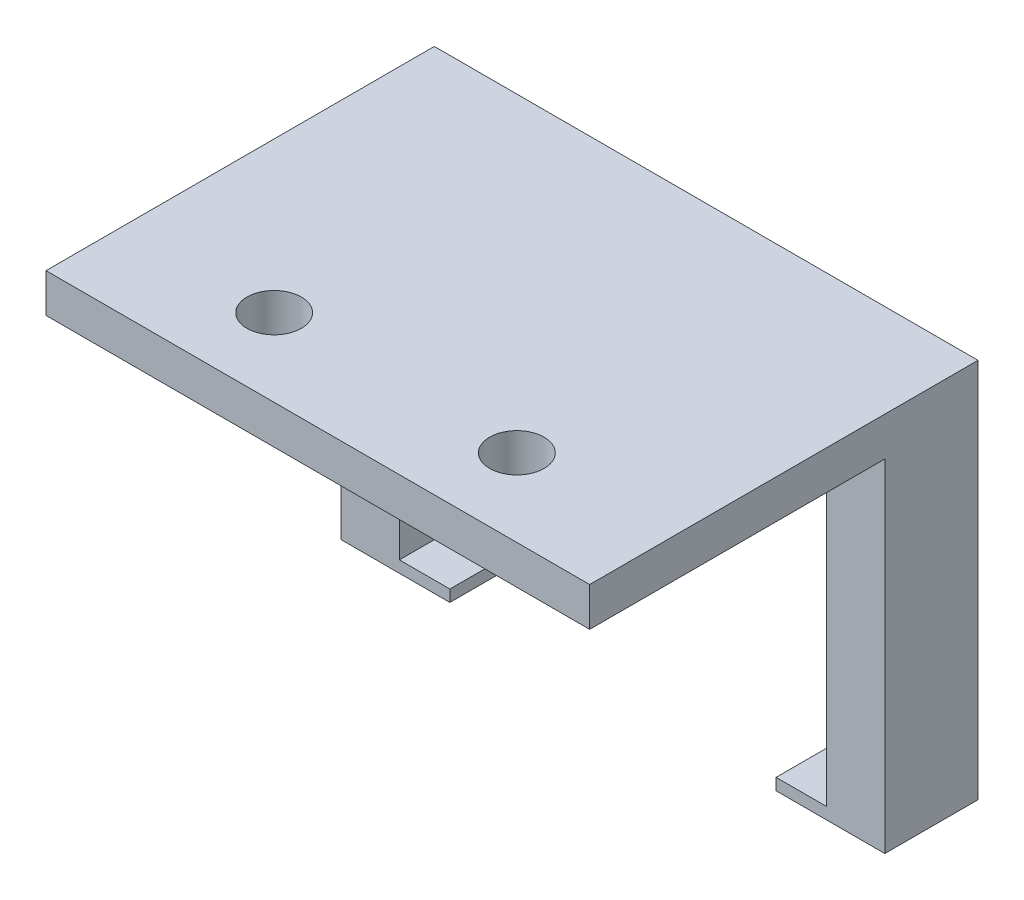
from build123d import *

# Parameters (mm, degrees)
SKETCH3_W           = 35.56
SKETCH3_H           = 25.4
SKETCH3_R           = 1.778
BOSS_EXTRUDE3_DEPTH = 2.54
SKETCH4_W           = 3.81
SKETCH4_H           = 11.176
BOSS_EXTRUDE4_DEPTH = 22.352
SKETCH5_W           = 11.176
SKETCH5_H           = 0.762
BOSS_EXTRUDE5_DEPTH = 3.302
SKETCH6_W           = 11.176
SKETCH6_H           = 0.762
BOSS_EXTRUDE6_DEPTH = 3.302
SKETCH7_W           = 35.56
SKETCH7_H           = 22.352
CUT_EXTRUDE1_DEPTH  = 5.08


with BuildPart() as part:
    # Sketch3 → Boss-Extrude3 (new body)
    with BuildSketch(Plane(origin=(0, 0, 0), x_dir=(1, 0, 0), z_dir=(0, 1, 0))):
        with Locations((6.262748092, -0.232671756)):
            Rectangle(SKETCH3_W, SKETCH3_H)
        with Locations((-1.674751908, -7.852671756)):
            Circle(SKETCH3_R, mode=Mode.SUBTRACT)
        with Locations((14.200248092, -7.852671756)):
            Circle(SKETCH3_R, mode=Mode.SUBTRACT)
    extrude(amount=BOSS_EXTRUDE3_DEPTH)

    # Sketch4 → Boss-Extrude4 (add)
    with BuildSketch(Plane.XZ):
        with Locations((-9.612251908, -6.879328244)):
            Rectangle(SKETCH4_W, SKETCH4_H)
        with Locations((22.137748092, -6.879328244)):
            Rectangle(SKETCH4_W, SKETCH4_H)
    extrude(amount=BOSS_EXTRUDE4_DEPTH)

    # Sketch5 → Boss-Extrude5 (add)
    with BuildSketch(Plane(origin=(-7.707251908, 0, 0), x_dir=(0, 0, -1), z_dir=(1, 0, 0))):
        with Locations((6.879328244, -21.971)):
            Rectangle(SKETCH5_W, SKETCH5_H)
    extrude(amount=BOSS_EXTRUDE5_DEPTH)

    # Sketch6 → Boss-Extrude6 (add)
    with BuildSketch(Plane.ZY.offset(-20.232748092)):
        with Locations((-6.879328244, -21.971)):
            Rectangle(SKETCH6_W, SKETCH6_H)
    extrude(amount=BOSS_EXTRUDE6_DEPTH)

    # Sketch7 → Cut-Extrude1 (cut)
    with BuildSketch(Plane.XY.offset(-1.291328244)):
        with Locations((6.262748092, -11.176)):
            Rectangle(SKETCH7_W, SKETCH7_H)
    extrude(amount=-CUT_EXTRUDE1_DEPTH, mode=Mode.SUBTRACT)


solid = part.part
